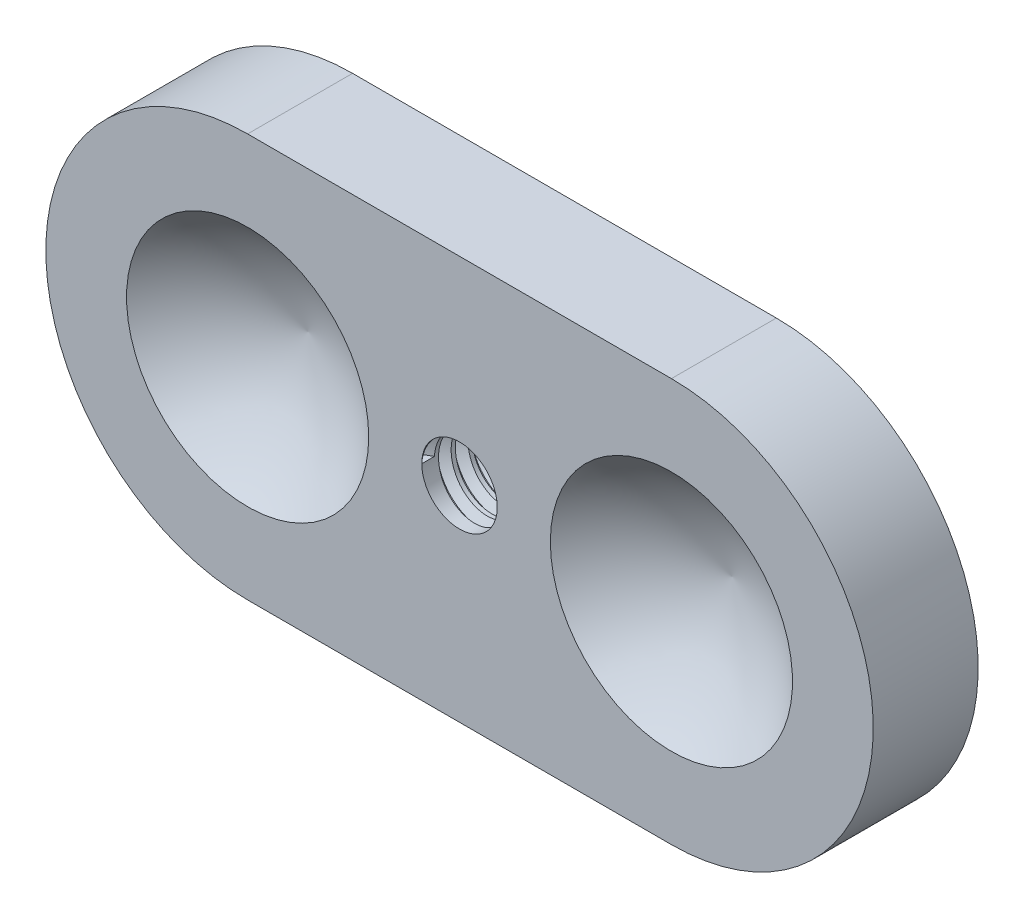
from build123d import *

# Parameters (mm, degrees)
BOSS_EXTRUDE1_DEPTH   = 3.302
F_4_48_TAPPED_HOLE3_D = 2.3749
THREAD1_PITCH         = 0.529166667


with BuildPart() as part:
    # Sketch1 → Boss-Extrude1 (new body)
    with BuildSketch(Plane.XY):
        with BuildLine():
            Line((-6.6675, 6.246317311), (6.6675, 6.246317311))
            ThreePointArc((6.6675, 6.246317311), (13.0175, -0.103682689), (6.6675, -6.453682689))
            Line((6.6675, -6.453682689), (-6.6675, -6.453682689))
            ThreePointArc((-6.6675, -6.453682689), (-13.0175, -0.103682689), (-6.6675, 6.246317311))
        make_face()
    extrude(amount=BOSS_EXTRUDE1_DEPTH)

    # Sketch4 → Cut-Revolve1 (revolve, cut)
    with BuildSketch(Plane(origin=(6.6675, 0, 0), x_dir=(0, 0, -1), z_dir=(1, 0, 0))):
        with BuildLine():
            ThreePointArc((-1.397, -0.103682689), (-2.038412152, 1.956861235), (-3.302, 3.706317311))
            Line((-3.302, 3.706317311), (-3.302, -0.103682689))
            Line((-3.302, -0.103682689), (-1.397, -0.103682689))
        make_face()
    cut_revolve1 = revolve(axis=Axis((6.6675, -0.103682689, 3.302), (0, 0, 1)), mode=Mode.SUBTRACT)

    # Mirror1: Cut-Revolve1 across plane
    add(cut_revolve1.mirror(Plane(origin=(0, 0, 0), x_dir=(0, 0, 1), z_dir=(1, 0, 0))), mode=Mode.SUBTRACT)

    # #4-48 Tapped Hole3 (through all)
    with Locations(Plane.XY.offset(3.302)):
        with Locations((0, 0)):
            Hole(F_4_48_TAPPED_HOLE3_D / 2)

    # Thread1: the profile of Thread Profile1 profile screwed along a right-hand helix of 11.099213 turns, 6 arcs to a turn; built about Z, then put on its axis
    thread1_z = Axis((0, 0, 0), (0, 0, 1))
    thread1_corners = [(1.18715, 0, -0.000173205), (1.473869859, 0, 0.165364583), (1.473869859, 0, 0.231510416), (1.18715, 0, 0.397048204)]
    with BuildLine(mode=Mode.PRIVATE) as thread1_profile:
        Line(thread1_corners[0], thread1_corners[1])
        Line(thread1_corners[1], thread1_corners[2])
        Line(thread1_corners[2], thread1_corners[3])
        Line(thread1_corners[3], thread1_corners[0])
    thread1_cap = Face(thread1_profile.wire())
    thread1_turn_angles = [0, 30, 60, 90, 120, 150, 180, 210, 240, 270, 300, 330, 360]
    thread1_turn_weights = [1, 0.8660254037844387, 1, 0.8660254037844387, 1, 0.8660254037844387, 1, 0.8660254037844387, 1, 0.8660254037844387, 1, 0.8660254037844387, 1]
    thread1_turn_rails = [Edge.make_bspline([Vector(p[0], p[1], 0).rotate(thread1_z, thread1_turn_angles[k]) / thread1_turn_weights[k] + Vector(0, 0, p[2] + THREAD1_PITCH * thread1_turn_angles[k] / 360) for k in range(13)], [0, 0, 0, 1, 1, 2, 2, 3, 3, 4, 4, 5, 5, 6, 6, 6], 2, thread1_turn_weights) for p in thread1_corners]
    thread1_turn_sides = [Face.make_surface_from_curves(thread1_turn_rails[p[0]], thread1_turn_rails[p[1]]) for p in [(0, 1), (1, 2), (2, 3), (3, 0)]]
    thread1_last_angles = [3960, 3977.858267717, 3995.716535433]
    thread1_last_weights = [1, 0.9518180194750062, 1]
    thread1_last_rails = [Edge.make_bspline([Vector(p[0], p[1], 0).rotate(thread1_z, thread1_last_angles[k]) / thread1_last_weights[k] + Vector(0, 0, p[2] + THREAD1_PITCH * thread1_last_angles[k] / 360) for k in range(3)], [0, 0, 0, 1, 1, 1], 2, thread1_last_weights) for p in thread1_corners]
    thread1_last_sides = [Face.make_surface_from_curves(thread1_last_rails[p[0]], thread1_last_rails[p[1]]) for p in [(0, 1), (1, 2), (2, 3), (3, 0)]]
    thread1 = Plane(origin=(0, 0, 3.302), x_dir=(-1, 0, 0), z_dir=(0, 0, -1)) * Solid(Shell([*[p.moved(Location((0, 0, THREAD1_PITCH * i))) for i in range(11) for p in thread1_turn_sides], *thread1_last_sides, thread1_cap, thread1_cap.rotate(thread1_z, 3995.716535433).moved(Location((0, 0, THREAD1_PITCH * 3995.716535433 / 360)))]))
    add(thread1, mode=Mode.SUBTRACT)


solid = part.part
